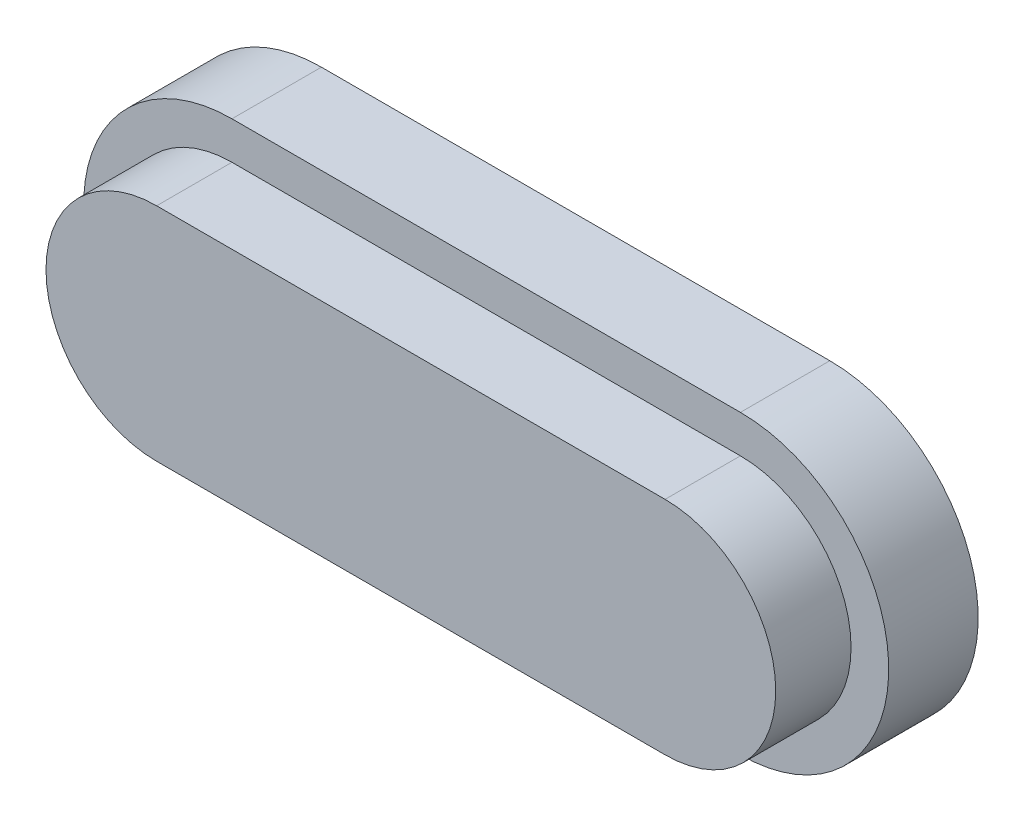
from build123d import *

# Parameters (mm, degrees)
SKETCH_1_R          = 3.15
SKETCH_1_W          = 10.8
SKETCH_1_H          = 6.3
EXTRUDE_1_DEPTH     = 1.9
EXTRUDE_4_DEPTH     = 1.6
MOVE_START          = 1.9
MOVE_BODY_1_DEPTH   = 1.6
MOVE_BODY_1_2_DEPTH = 1.6
SKETCH_6_R          = 0.9
EXTRUDE_5_DEPTH     = 1.1


# Read off the part's stored shape, not the designer's step: Тело-Переместить/Копировать1
with BuildPart() as part:
    # Эскиз1 → Бобышка-Вытянуть1 (new body)
    with BuildSketch(Plane.XY):
        with Locations((0, -3.15)):
            Circle(SKETCH_1_R)
        with Locations((10.8, -3.15)):
            Circle(SKETCH_1_R)
        with Locations((5.4, -3.15)):
            Rectangle(SKETCH_1_W, SKETCH_1_H)
    extrude(amount=EXTRUDE_1_DEPTH)

    # Эскиз6 → Бобышка-Вытянуть5 (add)
    with BuildSketch(Plane(origin=(0, 0, 0), x_dir=(-1, 0, 0), z_dir=(0, 0, -1))):
        with Locations(Location((-5.4, -3.15, 0), (0, 0, 180))):
            Circle(SKETCH_6_R)
        with Locations(Location((-7.7, -3.15, 0), (0, 0, 180))):
            Circle(SKETCH_6_R)
        with Locations(Location((-3.1, -3.15, 0), (0, 0, 180))):
            Circle(SKETCH_6_R)
    extrude(amount=EXTRUDE_5_DEPTH)


with BuildPart() as body_2:
    # Эскиз4 → Бобышка-Вытянуть4 (new body)
    with BuildSketch(Plane.XY.offset(1.9)):
        with BuildLine():
            ThreePointArc((0, 0), (-2.35, -2.35), (0, -4.7))
            Line((0, -4.7), (0, 0))
        make_face()
        with BuildLine():
            Line((0, 0), (0, -4.7))
            ThreePointArc((0, -4.7), (1.661700936, -4.011700936), (2.35, -2.35))
            ThreePointArc((2.35, -2.35), (1.661700936, -0.688299064), (0, 0))
        make_face()
        with BuildLine():
            ThreePointArc((2.35, -2.35), (1.661700936, -4.011700936), (0, -4.7))
            Line((0, -4.7), (10.8, -4.7))
            ThreePointArc((10.8, -4.7), (8.45, -2.35), (10.8, 0))
            Line((10.8, 0), (0, 0))
            ThreePointArc((0, 0), (1.661700936, -0.688299064), (2.35, -2.35))
        make_face()
        with BuildLine():
            ThreePointArc((10.8, 0), (8.45, -2.35), (10.8, -4.7))
            Line((10.8, -4.7), (10.8, 0))
        make_face()
        with BuildLine():
            Line((10.8, 0), (10.8, -4.7))
            ThreePointArc((10.8, -4.7), (12.461700936, -4.011700936), (13.15, -2.35))
            ThreePointArc((13.15, -2.35), (12.461700936, -0.688299064), (10.8, 0))
        make_face()
    extrude(amount=EXTRUDE_4_DEPTH)

    # Move Body 1 outline → Move Body 1 (cut)
    with BuildSketch(Plane.XY.offset(MOVE_START)):
        with BuildLine():
            ThreePointArc((0, 0), (-1.797567801, -0.83631245), (-2.315707235, -2.75))
            ThreePointArc((-2.315707235, -2.75), (-1.51368755, -1.352432199), (0, -0.8))
            Line((0, -0.8), (10.8, -0.8))
            ThreePointArc((10.8, -0.8), (12.31368755, -1.352432199), (13.115707235, -2.75))
            ThreePointArc((13.115707235, -2.75), (12.597567801, -0.83631245), (10.8, 0))
            Line((10.8, 0), (0, 0))
        make_face()
    extrude(amount=MOVE_BODY_1_DEPTH, mode=Mode.SUBTRACT)

    # Move Body 1 2 outline → Move Body 1 2 (add)
    with BuildSketch(Plane.XY.offset(MOVE_START)):
        with BuildLine():
            ThreePointArc((-2.315707235, -2.75), (-1.797567801, -4.66368755), (0, -5.5))
            Line((0, -5.5), (10.8, -5.5))
            ThreePointArc((10.8, -5.5), (12.597567801, -4.66368755), (13.115707235, -2.75))
            ThreePointArc((13.115707235, -2.75), (12.31368755, -4.147567801), (10.8, -4.7))
            Line((10.8, -4.7), (0, -4.7))
            ThreePointArc((0, -4.7), (-1.51368755, -4.147567801), (-2.315707235, -2.75))
        make_face()
    extrude(amount=MOVE_BODY_1_2_DEPTH)


solid = Compound([part.part, body_2.part])
